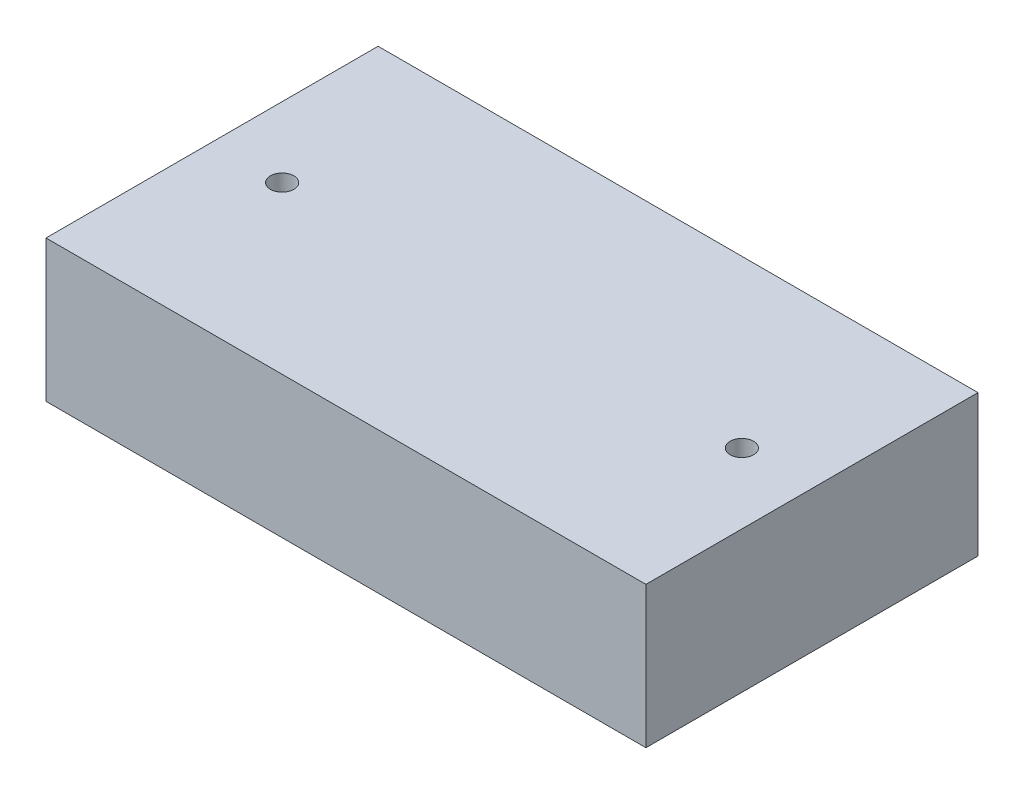
from build123d import *

# Parameters (mm, degrees)
SKETCH_1_W          = 76.6
SKETCH_1_H          = 42.4
EXTRUDE_1_DEPTH     = 18.07
SKETCH_2_R          = 1.5
CUT_EXTRUDE_1_DEPTH = 10


with BuildPart() as part:
    # Эскиз1 → Бобышка-Вытянуть1 (new body)
    with BuildSketch(Plane(origin=(0, 0, 0), x_dir=(1, 0, 0), z_dir=(0, 1, 0))):
        Rectangle(SKETCH_1_W, SKETCH_1_H)
    extrude(amount=EXTRUDE_1_DEPTH)

    # Эскиз2 → Вырез-Вытянуть1 (cut)
    with BuildSketch(Plane(origin=(0, 18.07, 0), x_dir=(1, 0, 0), z_dir=(0, 1, 0))):
        with Locations((29.35, 0)):
            Circle(SKETCH_2_R)
        with Locations((-29.35, 0)):
            Circle(SKETCH_2_R)
    extrude(amount=-CUT_EXTRUDE_1_DEPTH, mode=Mode.SUBTRACT)


solid = part.part
